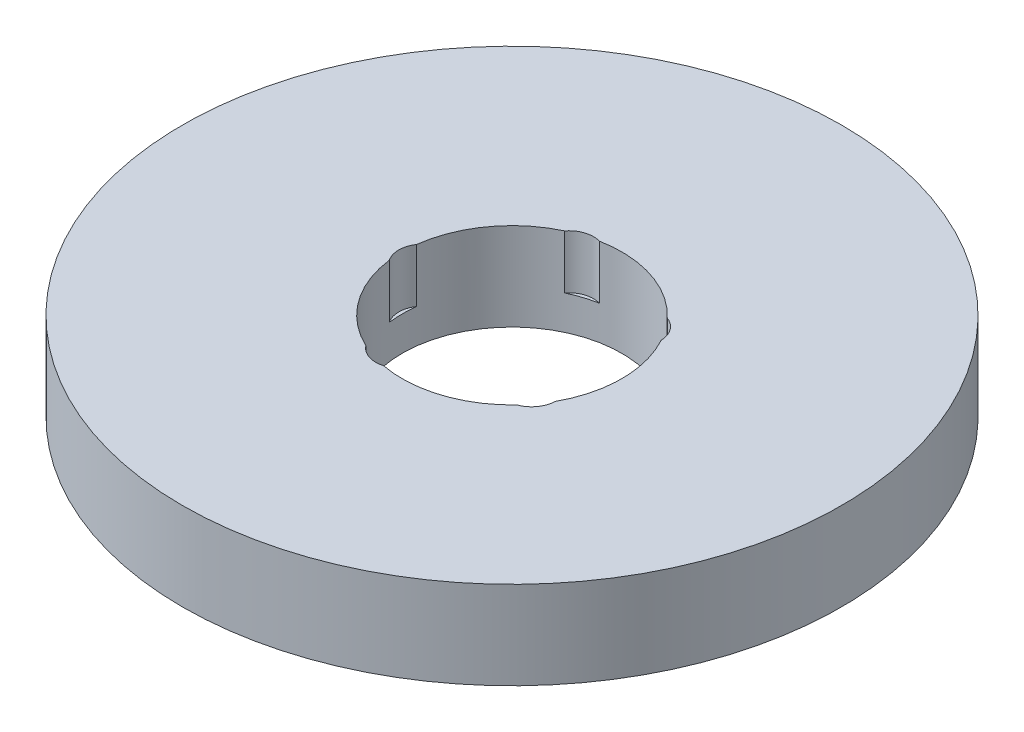
from build123d import *

# Parameters (mm, degrees)
SKETCH1_R           = 60
BOSS_EXTRUDE1_DEPTH = 16
SKETCH2_R           = 20
CUT_EXTRUDE1_DEPTH  = 87.34813258
SKETCH3_R           = 4.450235628
CUT_EXTRUDE2_DEPTH  = 9.787510627
CIRPATTERN1_COUNT   = 5


with BuildPart() as part:
    # Sketch1 → Boss-Extrude1 (new body)
    with BuildSketch(Plane(origin=(0, 0, 0), x_dir=(1, 0, 0), z_dir=(0, 1, 0))):
        Circle(SKETCH1_R)
    extrude(amount=BOSS_EXTRUDE1_DEPTH)

    # Sketch2 → Cut-Extrude1 (cut, through all)
    with BuildSketch(Plane(origin=(0, 0, 0), x_dir=(1, 0, 0), z_dir=(0, 1, 0))):
        Circle(SKETCH2_R)
    extrude(amount=CUT_EXTRUDE1_DEPTH, mode=Mode.SUBTRACT)

    # Sketch3 → Cut-Extrude2 (cut)
    with BuildSketch(Plane(origin=(0, 16, 0), x_dir=(1, 0, 0), z_dir=(0, 1, 0))):
        with Locations((-16.161888494, 0)):
            Circle(SKETCH3_R)
    cut_extrude2 = extrude(amount=-CUT_EXTRUDE2_DEPTH, mode=Mode.SUBTRACT)

    # CirPattern1: Cut-Extrude2 ×5 about axis
    cirpattern1_axis = Axis((0, 0, 0), (0, 1, 0))
    for i in range(1, CIRPATTERN1_COUNT):
        add(cut_extrude2.rotate(cirpattern1_axis, i * 360 / CIRPATTERN1_COUNT), mode=Mode.SUBTRACT)


solid = part.part
